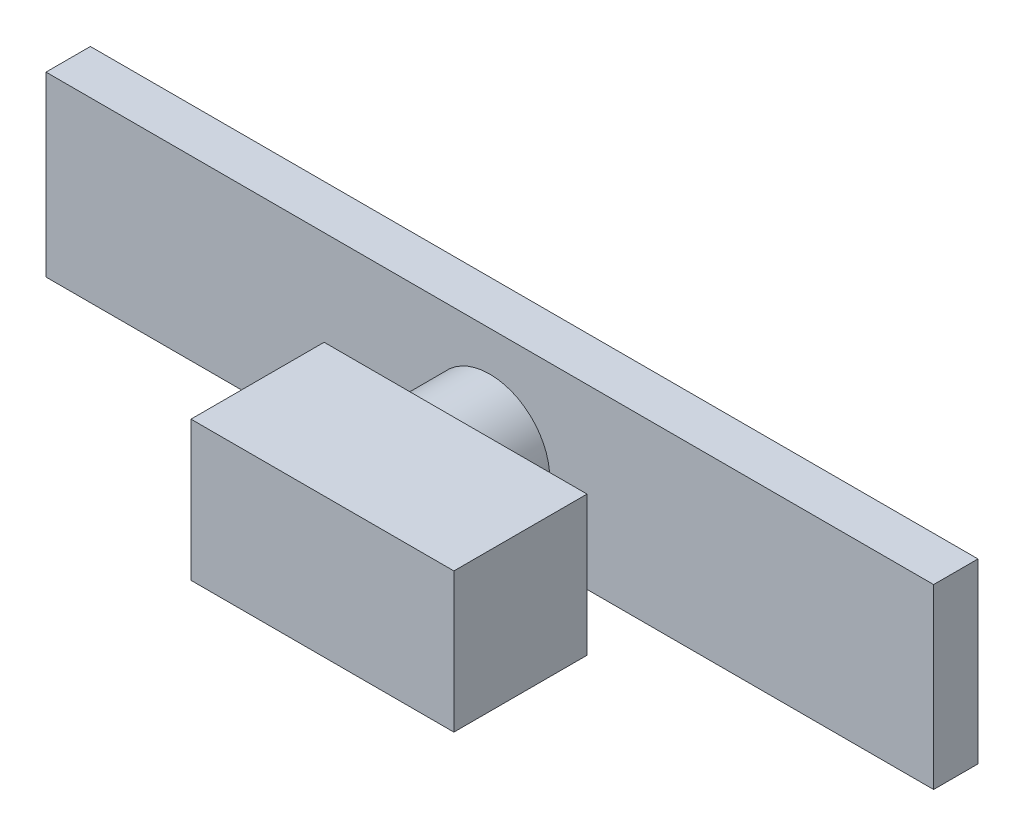
from build123d import *

# Parameters (mm, degrees)
SKETCH2_W             = 254
SKETCH2_H             = 12.7
BOSS_EXTRUDE1_DEPTH   = 50.8
SKETCH3_R             = 17.140791438
BOSS_EXTRUDE2_DEPTH   = 19.05
SKETCH4_W             = 75.235944222
SKETCH4_H             = 39.955088207
BOSS_EXTRUDE3_DEPTH   = 38.1
SCALE2_SCALE          = 0.06
BODY_MOVE_COPY1_ANGLE = 90
SCALE5_SCALE          = 0.25
SCALE6_SCALE          = 0.25


with BuildPart() as part:
    # Sketch2 → Boss-Extrude1 (new body)
    with BuildSketch(Plane.XY):
        with Locations((79.130769231, 14.898076923)):
            Rectangle(SKETCH2_W, SKETCH2_H)
    extrude(amount=BOSS_EXTRUDE1_DEPTH)

    # Sketch3 → Boss-Extrude2 (add)
    with BuildSketch(Plane(origin=(0, 21.248076923, 0), x_dir=(1, 0, 0), z_dir=(0, 1, 0))):
        with Locations((79.130769231, -28.483063876)):
            Circle(SKETCH3_R)
    extrude(amount=BOSS_EXTRUDE2_DEPTH)

    # Sketch4 → Boss-Extrude3 (add)
    with BuildSketch(Plane(origin=(0, 40.298076923, 0), x_dir=(1, 0, 0), z_dir=(0, 1, 0))):
        with Locations((88.38546847, -28.088530296)):
            Rectangle(SKETCH4_W, SKETCH4_H)
    extrude(amount=BOSS_EXTRUDE3_DEPTH)


with BuildPart() as part_1:
    # Scale2: scaled about (82.711857342, 33.041003565, 26.623476887)
    add(part.part.scale(SCALE2_SCALE).moved(Location((77.749145901, 31.058543351, 25.026068274))))


with BuildPart() as part_2:
    # Body-Move/Copy1: moved
    add(part_1.part.rotate(Axis((0, 33.666927966, 26.550068274), (1, 0, 0)), BODY_MOVE_COPY1_ANGLE))


with BuildPart() as part_3:
    # Body-Move/Copy3: moved
    add(part_2.part.moved(Location((-50.8, 0, -50.8))))


with BuildPart() as part_4:
    # Scale5: scaled about (31.911857342, 33.593519353, -24.875856127)
    add(part_3.part.scale(SCALE5_SCALE).moved(Location((23.933893006, 25.195139515, -18.656892095))))


with BuildPart() as part_5:
    # Body-Move/Copy9: moved
    add(part_4.part.moved(Location((-50.8, 0, 0))))


with BuildPart() as part_6:
    # Body-Move/Copy13: moved
    add(part_5.part.moved(Location((0, -50.8, 0))))


with BuildPart() as part_7:
    # Scale6: scaled about (-18.888142658, -17.206480647, -24.875856127)
    add(part_6.part.scale(SCALE6_SCALE).moved(Location((-14.166106993, -12.904860485, -18.656892095))))


solid = part_7.part
